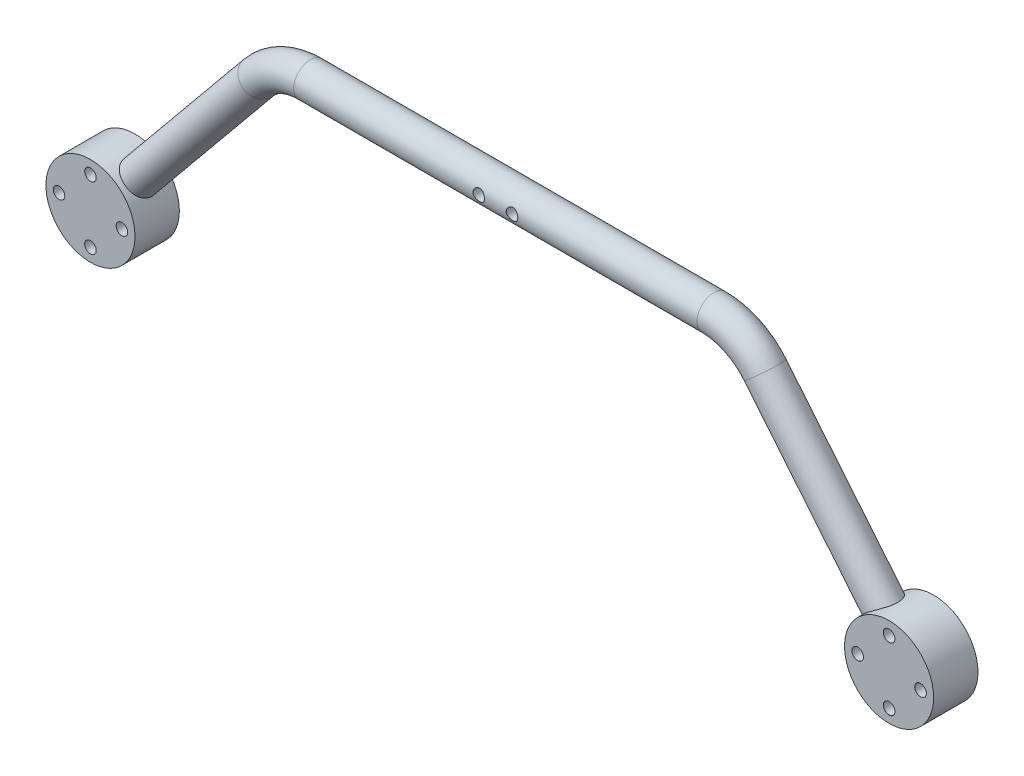
from build123d import *

# Parameters (mm, degrees)
SKETCH1_R                     = 25.499999927
BOSS_EXTRUDE1_DEPTH           = 25.4
BOSS_EXTRUDE1_2_DEPTH         = 25.4
SKETCH3_W                     = 3.3
SKETCH3_H                     = 25.4
CIRPATTERN1_COUNT             = 4
CIRPATTERN2_COUNT             = 4
SWEEP1_PROFILE_R              = 9.525
M6_CLEARANCE_HOLE2_AT_2_COUNT = 2
M6_CLEARANCE_HOLE2_AT_2_PITCH = 19.05


with BuildPart() as part:
    # Sketch1 → Boss-Extrude1 (new body)
    with BuildSketch(Plane.XY):
        with Locations((-228.6, -115.598107213)):
            Circle(SKETCH1_R)
    extrude(amount=BOSS_EXTRUDE1_DEPTH)

    # Sketch3 → M6 Clearance Hole1 (revolve, cut)
    with BuildSketch(Plane(origin=(-228.6, -97.598107272, 0), x_dir=(0, 1, 0), z_dir=(1, 0, 0))):
        with Locations((1.65, 12.7)):
            Rectangle(SKETCH3_W, SKETCH3_H)
    m6_clearance_hole1 = revolve(axis=Axis((-228.6, -97.598107272, -6.35), (0, 0, 1)), mode=Mode.SUBTRACT)

    # CirPattern1: M6 Clearance Hole1 ×4 about axis
    cirpattern1_axis = Axis((-228.6, -115.598107213, 25.4), (0, 0, -1))
    for i in range(1, CIRPATTERN1_COUNT):
        add(m6_clearance_hole1.rotate(cirpattern1_axis, i * 360 / CIRPATTERN1_COUNT), mode=Mode.SUBTRACT)

    # Sweep1: sweep along a path in Sketch4
    with BuildLine(Plane.XY.offset(12.7)) as sweep1_path:
        Line((-218.456478447, -103.48055256), (-144.898162444, -13.918492789))
        ThreePointArc((-144.898162444, -13.918492789), (-131.738940038, -3.654931959), (-115.455596166, 0))
        Line((-115.455596166, 0), (115.455596166, 0))
        ThreePointArc((115.455596166, 0), (131.738940038, -3.654931959), (144.898162444, -13.918492789))
        Line((144.898162444, -13.918492789), (218.456478447, -103.48055256))
    # Sweep1 profile (on start of the path) → Sweep1 (sweep)
    with BuildSketch(Plane(origin=(-218.456478447, -103.48055256, 12.7), x_dir=(0.7727707684381192, -0.634685228635076, 0), z_dir=(0.634685228635076, 0.7727707684381192, 0))):
        Circle(SWEEP1_PROFILE_R)
    sweep(path=sweep1_path.line)

    # Sketch25 → M6 Clearance Hole2 (revolve, cut)
    with BuildSketch(Plane(origin=(-9.525, 0, 22.225), x_dir=(0, -1, 0), z_dir=(1, 0, 0))):
        Polygon((0, 0), (0, 22.225), (3.3, 22.225), (3.3, 0.025), (3.325, 0), align=None)
    m6_clearance_hole2 = revolve(axis=Axis((-9.525, 0, 28.575), (0, 0, -1)), mode=Mode.SUBTRACT)

    # M6 Clearance Hole2 at 2: M6 Clearance Hole2 ×2
    with Locations(*[(i * M6_CLEARANCE_HOLE2_AT_2_PITCH, 0, 0) for i in range(1, M6_CLEARANCE_HOLE2_AT_2_COUNT)]):
        add(m6_clearance_hole2, mode=Mode.SUBTRACT)


with BuildPart() as body_2:
    # Sketch1 → Boss-Extrude1 2 (new body)
    with BuildSketch(Plane.XY):
        with Locations((228.6, -115.598107213)):
            Circle(SKETCH1_R)
    extrude(amount=BOSS_EXTRUDE1_2_DEPTH)

    # Sketch27 → M6 Clearance Hole3 (revolve, cut)
    with BuildSketch(Plane(origin=(228.6, -97.598107272, 25.4), x_dir=(0, -1, 0), z_dir=(1, 0, 0))):
        Polygon((0, 0), (0, 25.4), (3.3, 25.4), (3.3, 0.025), (3.325, 0), align=None)
    m6_clearance_hole3 = revolve(axis=Axis((228.6, -97.598107272, 31.75), (0, 0, -1)), mode=Mode.SUBTRACT)

    # CirPattern2: M6 Clearance Hole3 ×4 about axis
    cirpattern2_axis = Axis((228.6, -115.598107213, 25.4), (0, 0, -1))
    for i in range(1, CIRPATTERN2_COUNT):
        add(m6_clearance_hole3.rotate(cirpattern2_axis, i * 360 / CIRPATTERN2_COUNT), mode=Mode.SUBTRACT)


solid = Compound([part.part, body_2.part])
